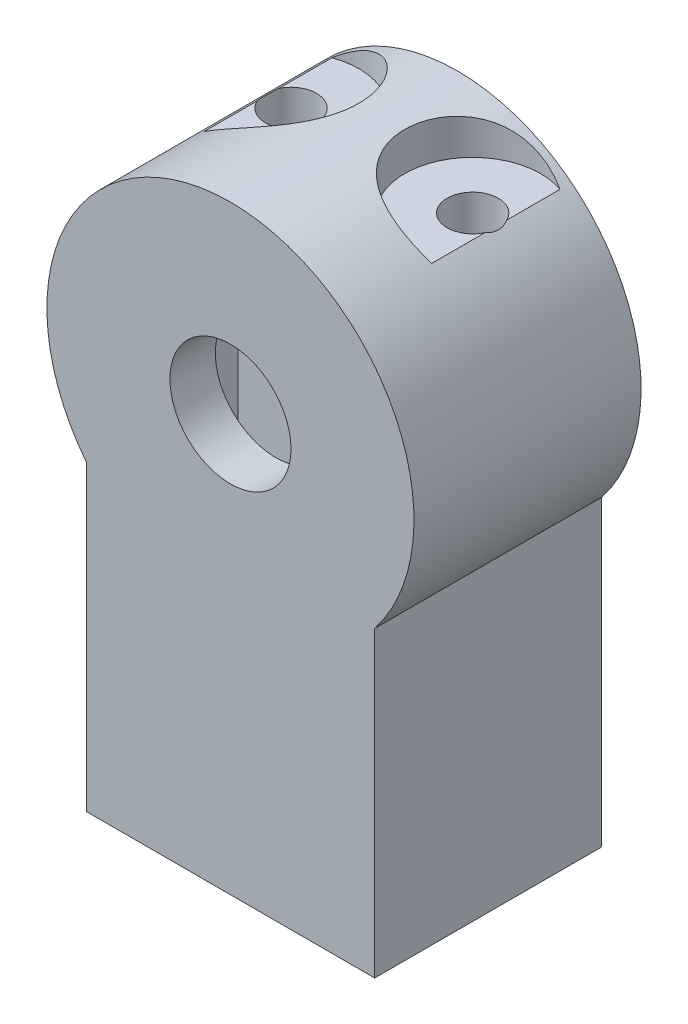
from build123d import *

# Parameters (mm, degrees)
SKETCH1_R               = 12
BOSS_EXTRUDE1_DEPTH     = 7
BOSS_EXTRUDE2_START     = -17
SKETCH2_R               = 8
BOSS_EXTRUDE2_DEPTH     = 17
CUT_EXTRUDE1_DEPTH      = 63.465210317
CUT_EXTRUDE1_DEPTH_BACK = 63.465210317
SKETCH3_R               = 3.38
CUT_EXTRUDE2_START      = 36
SKETCH4_R               = 9
CUT_EXTRUDE2_DEPTH      = 17
SKETCH5_W               = 24
SKETCH5_H               = 55
CUT_EXTRUDE3_DEPTH      = 7
BOSS_EXTRUDE4_START     = 7
SKETCH2_2_R             = 8
BOSS_EXTRUDE4_DEPTH     = 6


with BuildPart() as part:
    # Sketch1 → Boss-Extrude1 (new body)
    with BuildSketch(Plane.XY):
        with BuildLine():
            Line((-19.05, -55), (19.05, -55))
            Line((19.05, -55), (19.05, -15))
            ThreePointArc((19.05, -15), (0, 24.246700807), (-19.05, -15))
            Line((-19.05, -15), (-19.05, -55))
        make_face()
        Circle(SKETCH1_R, mode=Mode.SUBTRACT)
    extrude(amount=BOSS_EXTRUDE1_DEPTH)

    # Sketch2 → Boss-Extrude2 (add)
    with BuildSketch(Plane.XY.offset(BOSS_EXTRUDE2_START)):
        with BuildLine():
            Line((-19.05, -55), (19.05, -55))
            Line((19.05, -55), (19.05, -15))
            ThreePointArc((19.05, -15), (0, 24.246700807), (-19.05, -15))
            Line((-19.05, -15), (-19.05, -55))
        make_face()
        Circle(SKETCH2_R, mode=Mode.SUBTRACT)
    extrude(amount=BOSS_EXTRUDE2_DEPTH)

    # Sketch3 → Cut-Extrude1 (cut, two sides: drawn at the far end of the back side and taken through both)
    with BuildSketch(Plane(origin=(0, 0, 0), x_dir=(1, 0, 0), z_dir=(0, 1, 0)).offset(-CUT_EXTRUDE1_DEPTH_BACK)):
        with Locations((-12, 7)):
            Circle(SKETCH3_R)
        with Locations((12, 7)):
            Circle(SKETCH3_R)
    extrude(amount=CUT_EXTRUDE1_DEPTH + CUT_EXTRUDE1_DEPTH_BACK, mode=Mode.SUBTRACT)

    # Sketch4 → Cut-Extrude2 (cut)
    with BuildSketch(Plane(origin=(0, 0, 0), x_dir=(1, 0, 0), z_dir=(0, 1, 0)).offset(CUT_EXTRUDE2_START)):
        with Locations((-12, 7)):
            Circle(SKETCH4_R)
        with Locations((12, 7)):
            Circle(SKETCH4_R)
    extrude(amount=-CUT_EXTRUDE2_DEPTH, mode=Mode.SUBTRACT)

    # Sketch5 → Cut-Extrude3 (cut)
    with BuildSketch(Plane.XY):
        with Locations((0, -27.5)):
            Rectangle(SKETCH5_W, SKETCH5_H)
    extrude(amount=CUT_EXTRUDE3_DEPTH, mode=Mode.SUBTRACT)

    # Sketch2<2> → Boss-Extrude4 (add)
    with BuildSketch(Plane.XY.offset(BOSS_EXTRUDE4_START)):
        with BuildLine():
            Line((-19.05, -55), (19.05, -55))
            Line((19.05, -55), (19.05, -15))
            ThreePointArc((19.05, -15), (0, 24.246700807), (-19.05, -15))
            Line((-19.05, -15), (-19.05, -55))
        make_face()
        Circle(SKETCH2_2_R, mode=Mode.SUBTRACT)
    extrude(amount=BOSS_EXTRUDE4_DEPTH)


solid = part.part
